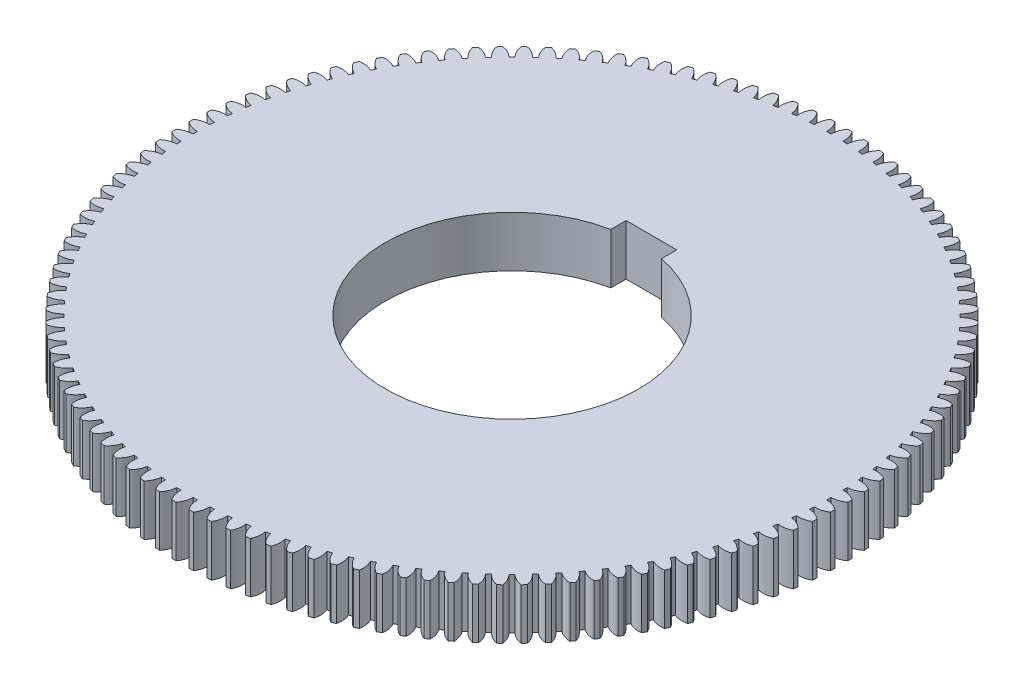
from build123d import *

# Parameters (mm, degrees)
IZIM1_R                     = 13
Y_KSEKLIK_EKSTR_ZYON1_DEPTH = 2
KES_EKSTR_ZYON1_DEPTH       = 19.493242009
KES_EKSTR_ZYON2_DEPTH       = 19.493242009
DAIRESEL_KAPLAMA1_COUNT     = 120


with BuildPart() as part:
    # Çizim1 → Yükseklik-Ekstrüzyon1 (new body)
    with BuildSketch(Plane(origin=(0, 0, 0), x_dir=(1, 0, 0), z_dir=(0, 1, 0))):
        Circle(IZIM1_R)
    extrude(amount=Y_KSEKLIK_EKSTR_ZYON1_DEPTH)

    # Çizim2 → Kes-Ekstrüzyon1 (cut, through all)
    with BuildSketch(Plane(origin=(0, 2, 0), x_dir=(1, 0, 0), z_dir=(0, 1, 0))):
        with BuildLine():
            Line((-0.0875, 12.5), (0.0875, 12.5))
            ThreePointArc((0.0875, 12.5), (0.154539563, 12.828092066), (0.35, 13.1))
            ThreePointArc((0.35, 13.1), (0, 13.213539425), (-0.35, 13.1))
            ThreePointArc((-0.35, 13.1), (-0.154539563, 12.828092066), (-0.0875, 12.5))
        make_face()
    kes_ekstr_zyon1 = extrude(amount=-KES_EKSTR_ZYON1_DEPTH, mode=Mode.SUBTRACT)

    # Çizim3 → Kes-Ekstrüzyon2 (cut, through all)
    with BuildSketch(Plane(origin=(0, 2, 0), x_dir=(1, 0, 0), z_dir=(0, 1, 0))):
        with BuildLine():
            Line((1, 4.898979486), (1, 5.5))
            Line((1, 5.5), (-1, 5.5))
            Line((-1, 5.5), (-1, 4.898979486))
            ThreePointArc((-1, 4.898979486), (0, -5), (1, 4.898979486))
        make_face()
    extrude(amount=-KES_EKSTR_ZYON2_DEPTH, mode=Mode.SUBTRACT)

    # Dairesel Kaplama1: Kes-Ekstrüzyon1 ×120 about axis
    dairesel_kaplama1_axis = Axis((0, 0, 0), (0, 1, 0))
    for i in range(1, DAIRESEL_KAPLAMA1_COUNT):
        add(kes_ekstr_zyon1.rotate(dairesel_kaplama1_axis, i * 360 / DAIRESEL_KAPLAMA1_COUNT), mode=Mode.SUBTRACT)


solid = part.part
